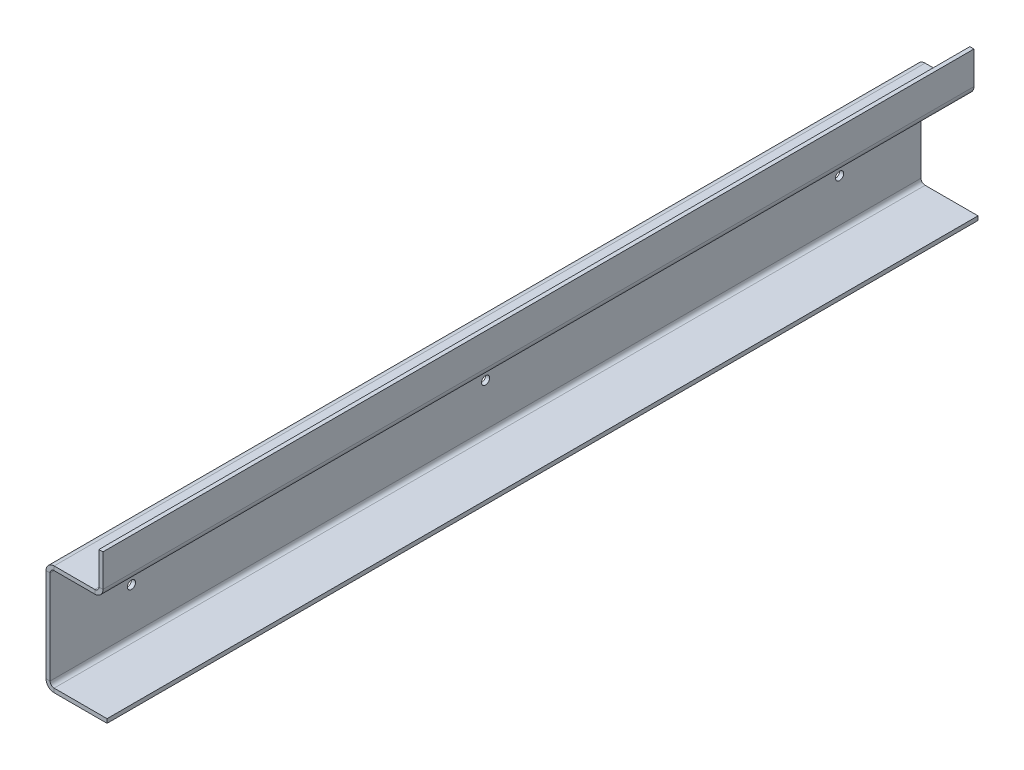
from build123d import *

# Parameters (mm, degrees)
BASE_FLANGE1_DEPTH           = 214
EDGE_FLANGE1_STRIP_W         = 12
EDGE_FLANGE1_STRIP_H         = 2
EDGE_FLANGE1_STRIP_CUT_DEPTH = 428
EDGE_FLANGE1_DEPTH           = 428
EDGE_FLANGE2_STRIP_W         = 12
EDGE_FLANGE2_STRIP_H         = 2
EDGE_FLANGE2_STRIP_CUT_DEPTH = 428
EDGE_FLANGE2_DEPTH           = 428
SKETCH6_R                    = 2
CUT_EXTRUDE2_DEPTH           = 10
LPATTERN3_COUNT              = 3
LPATTERN3_PITCH              = 174


# Sheet-metal steps are written as plain solids
with BuildPart() as part:
    # Sketch2 → Base-Flange1 (new, symmetric)
    with BuildSketch(Plane.XY):
        with BuildLine():
            Line((-30, 54), (-30, 4))
            ThreePointArc((-30, 4), (-28.828427125, 1.171572875), (-26, 0))
            Line((-26, 0), (0, 0))
            Line((0, 0), (0, 2))
            Line((0, 2), (-26, 2))
            ThreePointArc((-26, 2), (-27.414213562, 2.585786438), (-28, 4))
            Line((-28, 4), (-28, 54))
            Line((-28, 54), (-30, 54))
        make_face()
    extrude(amount=BASE_FLANGE1_DEPTH, both=True)

    # Edge-Flange1 strip (across the edge) → Edge-Flange1 strip cut (cut)
    with BuildSketch(Plane(origin=(-28, 54, -214), x_dir=(0, -1, 0), z_dir=(0, 0, 1))):
        with Locations((-2, -1)):
            Rectangle(EDGE_FLANGE1_STRIP_W, EDGE_FLANGE1_STRIP_H)
    extrude(amount=EDGE_FLANGE1_STRIP_CUT_DEPTH, mode=Mode.SUBTRACT)

    # Edge-Flange1 section (across the edge) → Edge-Flange1 (add)
    with BuildSketch(Plane(origin=(-28, 54, -214), x_dir=(0, -1, 0), z_dir=(0, 0, 1))):
        with BuildLine():
            Line((0, 2), (0, 26))
            Line((0, 26), (2, 26))
            Line((2, 26), (2, 2))
            ThreePointArc((2, 2), (2.585786438, 0.585786438), (4, 0))
            Line((4, 0), (4, -2))
            ThreePointArc((4, -2), (1.171572875, -0.828427125), (0, 2))
        make_face()
    extrude(amount=EDGE_FLANGE1_DEPTH)

    # Edge-Flange2 strip (across the edge) → Edge-Flange2 strip cut (cut)
    with BuildSketch(Plane(origin=(-2, 54, 214), x_dir=(-1, 0, 0), z_dir=(0, 0, -1))):
        with Locations((-2, -1)):
            Rectangle(EDGE_FLANGE2_STRIP_W, EDGE_FLANGE2_STRIP_H)
    extrude(amount=EDGE_FLANGE2_STRIP_CUT_DEPTH, mode=Mode.SUBTRACT)

    # Edge-Flange2 section (across the edge) → Edge-Flange2 (add)
    with BuildSketch(Plane(origin=(-2, 54, 214), x_dir=(-1, 0, 0), z_dir=(0, 0, -1))):
        with BuildLine():
            Line((0, 2), (0, 18))
            Line((0, 18), (2, 18))
            Line((2, 18), (2, 2))
            ThreePointArc((2, 2), (2.585786438, 0.585786438), (4, 0))
            Line((4, 0), (4, -2))
            ThreePointArc((4, -2), (1.171572875, -0.828427125), (0, 2))
        make_face()
    extrude(amount=EDGE_FLANGE2_DEPTH)

    # Sketch6 → Cut-Extrude2 (cut)
    with BuildSketch(Plane(origin=(-28, 0, 0), x_dir=(0, 0, -1), z_dir=(1, 0, 0))):
        with Locations((174, 25)):
            Circle(SKETCH6_R)
    cut_extrude2 = extrude(amount=-CUT_EXTRUDE2_DEPTH, mode=Mode.SUBTRACT)

    # LPattern3: Cut-Extrude2 ×3
    with Locations(*[(0, 0, i * LPATTERN3_PITCH) for i in range(1, LPATTERN3_COUNT)]):
        add(cut_extrude2, mode=Mode.SUBTRACT)


solid = part.part
